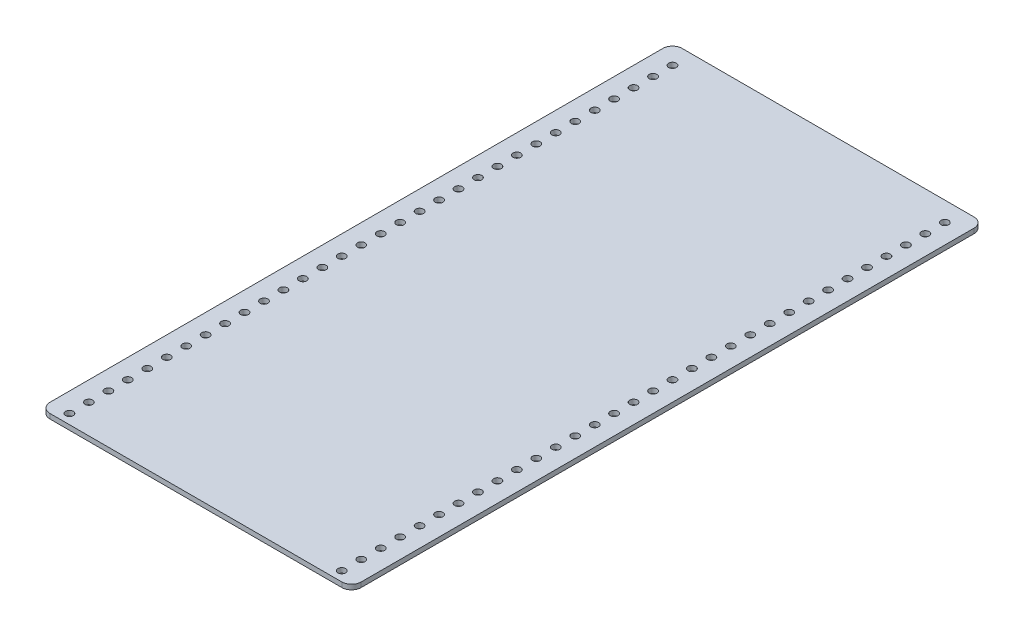
from build123d import *

# Parameters (mm, degrees)
BOSS_EXTRUDE1_DEPTH = 3.175
SKETCH3_R           = 2.5
CUT_EXTRUDE2_DEPTH  = 318.504039318


with BuildPart() as part:
    # Sketch1 → Boss-Extrude1 (new body)
    with BuildSketch(Plane(origin=(0, 0, 0), x_dir=(1, 0, 0), z_dir=(0, 1, 0))):
        with BuildLine():
            Line((-77.88977591, 294.358963585), (112.61022409, 294.358963585))
            ThreePointArc((112.61022409, 294.358963585), (117.10035215, 292.499091646), (118.96022409, 288.008963585))
            Line((118.96022409, 288.008963585), (118.96022409, -112.041036415))
            ThreePointArc((118.96022409, -112.041036415), (117.10035215, -116.531164475), (112.61022409, -118.391036415))
            Line((112.61022409, -118.391036415), (-77.88977591, -118.391036415))
            ThreePointArc((-77.88977591, -118.391036415), (-82.379903971, -116.531164475), (-84.23977591, -112.041036415))
            Line((-84.23977591, -112.041036415), (-84.23977591, 288.008963585))
            ThreePointArc((-84.23977591, 288.008963585), (-82.379903971, 292.499091646), (-77.88977591, 294.358963585))
        make_face()
    extrude(amount=BOSS_EXTRUDE1_DEPTH)

    # Sketch3 → Cut-Extrude2 (cut, through all)
    with BuildSketch(Plane(origin=(0, 3.175, 0), x_dir=(1, 0, 0), z_dir=(0, 1, 0))):
        with Locations((-71.53977591, 281.658963585)):
            Circle(SKETCH3_R)
        with Locations((106.26022409, 281.658963585)):
            Circle(SKETCH3_R)
        with Locations((-71.53977591, 268.958963585)):
            Circle(SKETCH3_R)
        with Locations((106.26022409, 268.958963585)):
            Circle(SKETCH3_R)
        with Locations((-71.53977591, 256.258963585)):
            Circle(SKETCH3_R)
        with Locations((106.26022409, 256.258963585)):
            Circle(SKETCH3_R)
        with Locations((-71.53977591, 243.558963585)):
            Circle(SKETCH3_R)
        with Locations((106.26022409, 243.558963585)):
            Circle(SKETCH3_R)
        with Locations((-71.53977591, 230.858963585)):
            Circle(SKETCH3_R)
        with Locations((106.26022409, 230.858963585)):
            Circle(SKETCH3_R)
        with Locations((-71.53977591, 218.158963585)):
            Circle(SKETCH3_R)
        with Locations((106.26022409, 218.158963585)):
            Circle(SKETCH3_R)
        with Locations((-71.53977591, 205.458963585)):
            Circle(SKETCH3_R)
        with Locations((106.26022409, 205.458963585)):
            Circle(SKETCH3_R)
        with Locations((-71.53977591, 192.758963585)):
            Circle(SKETCH3_R)
        with Locations((106.26022409, 192.758963585)):
            Circle(SKETCH3_R)
        with Locations((-71.53977591, 180.058963585)):
            Circle(SKETCH3_R)
        with Locations((106.26022409, 180.058963585)):
            Circle(SKETCH3_R)
        with Locations((-71.53977591, 167.358963585)):
            Circle(SKETCH3_R)
        with Locations((106.26022409, 167.358963585)):
            Circle(SKETCH3_R)
        with Locations((-71.53977591, 154.658963585)):
            Circle(SKETCH3_R)
        with Locations((106.26022409, 154.658963585)):
            Circle(SKETCH3_R)
        with Locations((-71.53977591, 141.958963585)):
            Circle(SKETCH3_R)
        with Locations((106.26022409, 141.958963585)):
            Circle(SKETCH3_R)
        with Locations((-71.53977591, 129.258963585)):
            Circle(SKETCH3_R)
        with Locations((106.26022409, 129.258963585)):
            Circle(SKETCH3_R)
        with Locations((-71.53977591, 116.558963585)):
            Circle(SKETCH3_R)
        with Locations((106.26022409, 116.558963585)):
            Circle(SKETCH3_R)
        with Locations((-71.53977591, 103.858963585)):
            Circle(SKETCH3_R)
        with Locations((106.26022409, 103.858963585)):
            Circle(SKETCH3_R)
        with Locations((-71.53977591, 91.158963585)):
            Circle(SKETCH3_R)
        with Locations((106.26022409, 91.158963585)):
            Circle(SKETCH3_R)
        with Locations((-71.53977591, 78.458963585)):
            Circle(SKETCH3_R)
        with Locations((106.26022409, 78.458963585)):
            Circle(SKETCH3_R)
        with Locations((-71.53977591, 65.758963585)):
            Circle(SKETCH3_R)
        with Locations((106.26022409, 65.758963585)):
            Circle(SKETCH3_R)
        with Locations((-71.53977591, 53.058963585)):
            Circle(SKETCH3_R)
        with Locations((106.26022409, 53.058963585)):
            Circle(SKETCH3_R)
        with Locations((-71.53977591, 40.358963585)):
            Circle(SKETCH3_R)
        with Locations((106.26022409, 40.358963585)):
            Circle(SKETCH3_R)
        with Locations((-71.53977591, 27.658963585)):
            Circle(SKETCH3_R)
        with Locations((106.26022409, 27.658963585)):
            Circle(SKETCH3_R)
        with Locations((-71.53977591, 14.958963585)):
            Circle(SKETCH3_R)
        with Locations((106.26022409, 14.958963585)):
            Circle(SKETCH3_R)
        with Locations((-71.53977591, 2.258963585)):
            Circle(SKETCH3_R)
        with Locations((106.26022409, 2.258963585)):
            Circle(SKETCH3_R)
        with Locations((-71.53977591, -10.441036415)):
            Circle(SKETCH3_R)
        with Locations((106.26022409, -10.441036415)):
            Circle(SKETCH3_R)
        with Locations((-71.53977591, -23.141036415)):
            Circle(SKETCH3_R)
        with Locations((106.26022409, -23.141036415)):
            Circle(SKETCH3_R)
        with Locations((-71.53977591, -35.841036415)):
            Circle(SKETCH3_R)
        with Locations((106.26022409, -35.841036415)):
            Circle(SKETCH3_R)
        with Locations((-71.53977591, -48.541036415)):
            Circle(SKETCH3_R)
        with Locations((106.26022409, -48.541036415)):
            Circle(SKETCH3_R)
        with Locations((-71.53977591, -61.241036415)):
            Circle(SKETCH3_R)
        with Locations((106.26022409, -61.241036415)):
            Circle(SKETCH3_R)
        with Locations((-71.53977591, -73.941036415)):
            Circle(SKETCH3_R)
        with Locations((106.26022409, -73.941036415)):
            Circle(SKETCH3_R)
        with Locations((-71.53977591, -86.641036415)):
            Circle(SKETCH3_R)
        with Locations((106.26022409, -86.641036415)):
            Circle(SKETCH3_R)
        with Locations((-71.53977591, -99.341036415)):
            Circle(SKETCH3_R)
        with Locations((106.26022409, -99.341036415)):
            Circle(SKETCH3_R)
        with Locations((-71.53977591, -112.041036415)):
            Circle(SKETCH3_R)
        with Locations((106.26022409, -112.041036415)):
            Circle(SKETCH3_R)
        with Locations((-71.53977591, -124.741036415)):
            Circle(SKETCH3_R)
        with Locations((106.26022409, -124.741036415)):
            Circle(SKETCH3_R)
        with Locations((-71.53977591, -137.441036415)):
            Circle(SKETCH3_R)
        with Locations((106.26022409, -137.441036415)):
            Circle(SKETCH3_R)
        with Locations((-71.53977591, -150.141036415)):
            Circle(SKETCH3_R)
        with Locations((106.26022409, -150.141036415)):
            Circle(SKETCH3_R)
    extrude(amount=-CUT_EXTRUDE2_DEPTH, mode=Mode.SUBTRACT)


solid = part.part
